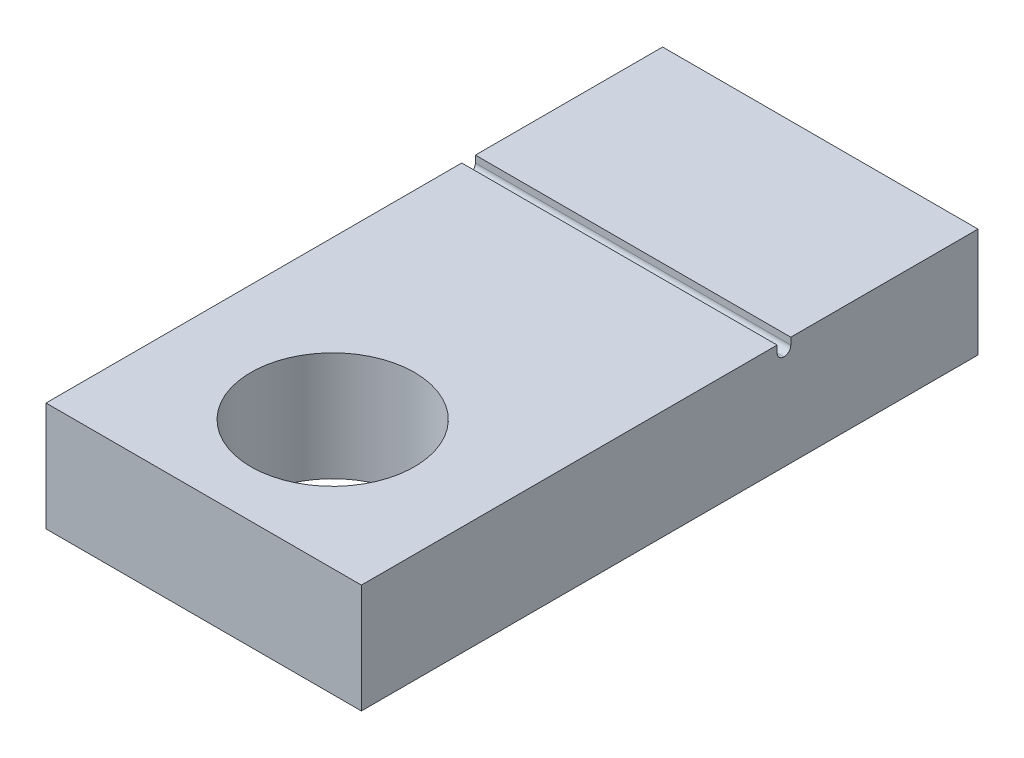
from build123d import *

# Parameters (mm, degrees)
BOSS_EXTRUDE1_DEPTH = 8
SKETCH2_W           = 23.137445614
SKETCH2_H           = 10.306738945
BOSS_EXTRUDE2_DEPTH = 8
SKETCH4_W           = 1
SKETCH4_H           = 2
CUT_EXTRUDE1_DEPTH  = 60
FILLET1_R           = 0.5


with BuildPart() as part:
    # Sketch1 → Boss-Extrude1 (new body)
    with BuildSketch(Plane(origin=(0, 0, 0), x_dir=(1, 0, 0), z_dir=(0, 1, 0))):
        with BuildLine():
            Line((11.568722807, -17.464704369), (11.568722807, 17.464704369))
            Line((11.568722807, 17.464704369), (0, 17.464704369))
            Line((0, 17.464704369), (0, -2.002357687))
            ThreePointArc((0, -2.002357687), (4.242640687, -3.759717), (6, -8.002357687))
            ThreePointArc((6, -8.002357687), (4.242640687, -12.244998375), (0, -14.002357687))
            Line((0, -14.002357687), (0, -17.464704369))
            Line((0, -17.464704369), (11.568722807, -17.464704369))
        make_face()
        with BuildLine():
            Line((0, -2.002357687), (0, 17.464704369))
            Line((0, 17.464704369), (-11.568722807, 17.464704369))
            Line((-11.568722807, 17.464704369), (-11.568722807, -17.464704369))
            Line((-11.568722807, -17.464704369), (0, -17.464704369))
            Line((0, -17.464704369), (0, -14.002357687))
            ThreePointArc((0, -14.002357687), (-6, -8.002357687), (0, -2.002357687))
        make_face()
    extrude(amount=BOSS_EXTRUDE1_DEPTH)

    # Sketch2 → Boss-Extrude2 (add)
    with BuildSketch(Plane.XZ):
        with Locations((0, -22.618073841)):
            Rectangle(SKETCH2_W, SKETCH2_H)
    extrude(amount=-BOSS_EXTRUDE2_DEPTH)

    # Sketch4 → Cut-Extrude1 (cut)
    with BuildSketch(Plane(origin=(11.568722807, 0, 0), x_dir=(0, 0, -1), z_dir=(1, 0, 0))):
        with Locations((13.536168456, 8)):
            Rectangle(SKETCH4_W, SKETCH4_H)
    extrude(amount=-CUT_EXTRUDE1_DEPTH, mode=Mode.SUBTRACT)

    # Fillet1
    fillet1_edges = [part.edges().sort_by_distance(p)[0] for p in [
        (0, 7, -14.036168456),
        (0, 7, -13.036168456),
    ]]
    fillet(fillet1_edges, radius=FILLET1_R - 0.0001)  # a hair under: the kernel refuses the full size


solid = part.part
